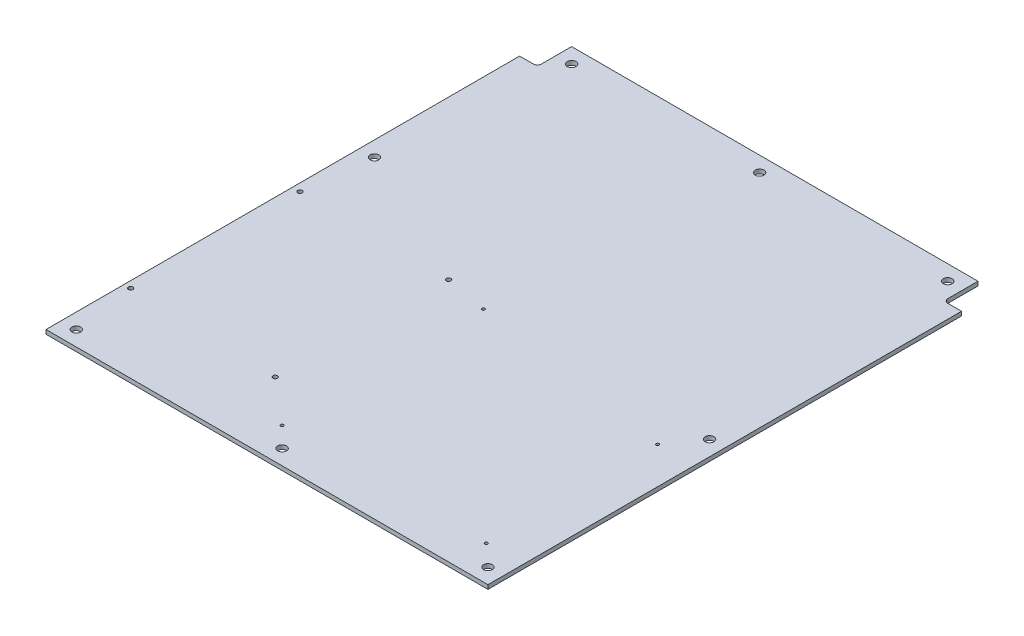
from build123d import *

# Parameters (mm, degrees)
SKETCH1_W                   = 340.868
SKETCH1_H                   = 391.668
BOSS_EXTRUDE1_DEPTH         = 3.175
CUT_EXTRUDE1_DEPTH          = 10
F_1_4_CLEARANCE_HOLE1_D     = 6.7564
F_1_4_CLEARANCE_HOLE1_DEPTH = 18.75
F_1_4_CLEARANCE_HOLE1_TIP   = 2.029827343
F_4_40_TAPPED_HOLE1_D       = 2.2606
F_4_40_TAPPED_HOLE1_DEPTH   = 7.6
F_4_40_TAPPED_HOLE1_TIP     = 0.679152758
F_8_32_TAPPED_HOLE1_D       = 3.4544
F_8_32_TAPPED_HOLE1_DEPTH   = 10.71
F_8_32_TAPPED_HOLE1_TIP     = 1.037806461


with BuildPart() as part:
    # Sketch1 → Boss-Extrude1 (new body)
    with BuildSketch(Plane(origin=(0, 0, 0), x_dir=(1, 0, 0), z_dir=(0, 1, 0))):
        Rectangle(SKETCH1_W, SKETCH1_H)
    extrude(amount=BOSS_EXTRUDE1_DEPTH)

    # Sketch2 → Cut-Extrude1 (cut)
    with BuildSketch(Plane(origin=(0, 3.175, 0), x_dir=(1, 0, 0), z_dir=(0, 1, 0))):
        with BuildLine():
            Line((-170.434, 195.834), (-156.718, 195.834))
            Line((-156.718, 195.834), (-156.718, 172.593))
            ThreePointArc((-156.718, 172.593), (-157.64793597, 170.34793597), (-159.893, 169.418))
            Line((-159.893, 169.418), (-170.434, 169.418))
            Line((-170.434, 169.418), (-170.434, 195.834))
        make_face()
        with BuildLine():
            Line((170.434, 195.834), (156.718, 195.834))
            Line((156.718, 195.834), (156.718, 172.593))
            ThreePointArc((156.718, 172.593), (157.64793597, 170.34793597), (159.893, 169.418))
            Line((159.893, 169.418), (170.434, 169.418))
            Line((170.434, 169.418), (170.434, 195.834))
        make_face()
    extrude(amount=-CUT_EXTRUDE1_DEPTH, mode=Mode.SUBTRACT)

    # 1/4 Clearance Hole1
    with Locations(Plane(origin=(0, 3.175, 0), x_dir=(1, 0, 0), z_dir=(0, 1, 0))):
        with Locations((158.75, -184.15), (-158.75, -184.15), (158.75, -13.208), (0, -184.15), (0, 184.15), (-145.034, 184.15), (145.034, 184.15), (-158.75, 45.834)):
            Hole(F_1_4_CLEARANCE_HOLE1_D / 2, depth=F_1_4_CLEARANCE_HOLE1_DEPTH)
            with Locations((0, 0, -(F_1_4_CLEARANCE_HOLE1_DEPTH + F_1_4_CLEARANCE_HOLE1_TIP / 2))):  # 118° drill point
                Cone(0, F_1_4_CLEARANCE_HOLE1_D / 2, F_1_4_CLEARANCE_HOLE1_TIP, mode=Mode.SUBTRACT)

    # #4-40 Tapped Hole1
    with Locations(Plane(origin=(0, 3.175, 0), x_dir=(1, 0, 0), z_dir=(0, 1, 0))):
        with Locations((-15.34, -13.51), (142.14, -36.73), (142.14, -168.81), (-15.34, -168.81)):
            Hole(F_4_40_TAPPED_HOLE1_D / 2, depth=F_4_40_TAPPED_HOLE1_DEPTH)
            with Locations((0, 0, -(F_4_40_TAPPED_HOLE1_DEPTH + F_4_40_TAPPED_HOLE1_TIP / 2))):  # 118° drill point
                Cone(0, F_4_40_TAPPED_HOLE1_D / 2, F_4_40_TAPPED_HOLE1_TIP, mode=Mode.SUBTRACT)

    # #8-32 Tapped Hole1
    with Locations(Plane(origin=(0, 3.175, 0), x_dir=(1, 0, 0), z_dir=(0, 1, 0))):
        with Locations((-164.615471497, -5.789518293), (-165.334, -135.625), (-50.329450984, -139.163773828), (-48.457537185, -7.265133725)):
            Hole(F_8_32_TAPPED_HOLE1_D / 2, depth=F_8_32_TAPPED_HOLE1_DEPTH)
            with Locations((0, 0, -(F_8_32_TAPPED_HOLE1_DEPTH + F_8_32_TAPPED_HOLE1_TIP / 2))):  # 118° drill point
                Cone(0, F_8_32_TAPPED_HOLE1_D / 2, F_8_32_TAPPED_HOLE1_TIP, mode=Mode.SUBTRACT)


solid = part.part
